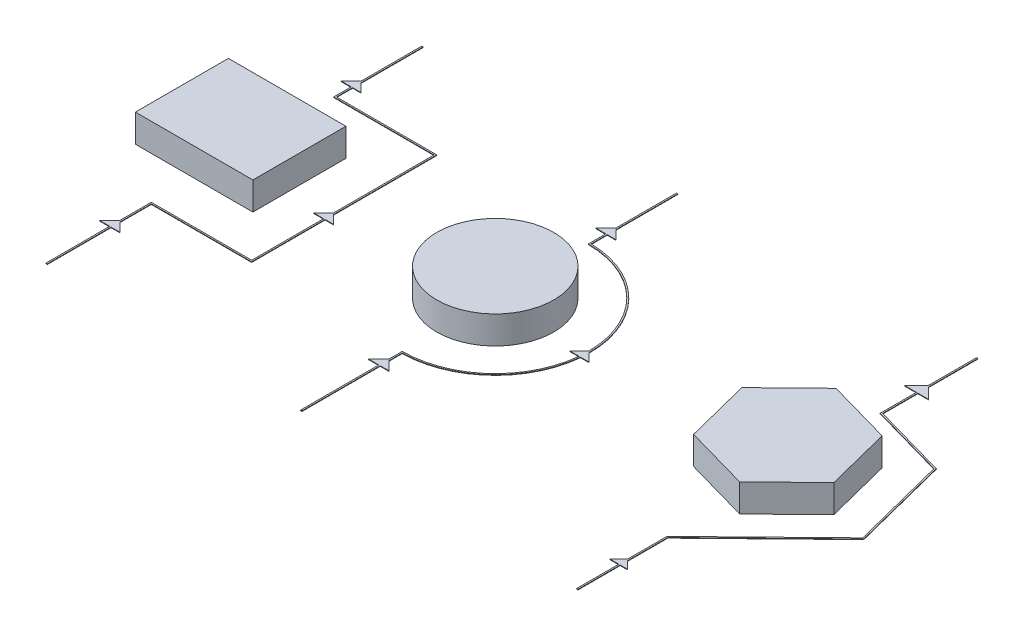
from build123d import *

# Parameters (mm, degrees)
SKETCH1_W             = 42.222572062
SKETCH1_H             = 33.426202882
BOSS_EXTRUDE1_DEPTH   = 10
BOSS_EXTRUDE1_2_DEPTH = 10
SKETCH1_R             = 21.024058424
BOSS_EXTRUDE1_3_DEPTH = 10
BOSS_EXTRUDE3_DEPTH   = 0.2
BOSS_EXTRUDE3_2_DEPTH = 0.2
BOSS_EXTRUDE3_3_DEPTH = 0.2
BOSS_EXTRUDE3_4_DEPTH = 0.2
BOSS_EXTRUDE3_5_DEPTH = 0.2
BOSS_EXTRUDE3_6_DEPTH = 0.2
BOSS_EXTRUDE3_7_DEPTH = 0.2
BOSS_EXTRUDE3_8_DEPTH = 0.2
EXTRUDE_THIN1_DEPTH   = 0.2


with BuildPart() as part:
    # Sketch1 → Boss-Extrude1 (new body)
    with BuildSketch(Plane(origin=(0, 0, 0), x_dir=(1, 0, 0), z_dir=(0, 1, 0))):
        with Locations((-158.114736003, 0)):
            Rectangle(SKETCH1_W, SKETCH1_H)
    extrude(amount=BOSS_EXTRUDE1_DEPTH)


with BuildPart() as body_2:
    # Sketch1 → Boss-Extrude1 2 (new body)
    with BuildSketch(Plane(origin=(0, 0, 0), x_dir=(1, 0, 0), z_dir=(0, 1, 0))):
        Polygon((61.534545535, -6.498313662), (55.637035061, 16.713101441), (32.586604687, 23.211415103), (15.433684787, 6.498313662), (21.331195261, -16.713101441), (44.381625635, -23.211415103), align=None)
    extrude(amount=BOSS_EXTRUDE1_2_DEPTH)


with BuildPart() as body_3:
    # Sketch1 → Boss-Extrude1 3 (new body)
    with BuildSketch(Plane(origin=(0, 0, 0), x_dir=(1, 0, 0), z_dir=(0, 1, 0))):
        with Locations((-66.632496535, 0)):
            Circle(SKETCH1_R)
    extrude(amount=BOSS_EXTRUDE1_3_DEPTH)


with BuildPart() as body_4:
    # Sketch1<5> → Boss-Extrude3 (new body)
    with BuildSketch(Plane(origin=(0, 0, 0), x_dir=(1, 0, 0), z_dir=(0, 1, 0))):
        Polygon((-161.789605496, 39.719403423), (-154.550133398, 39.719403423), (-158.169869447, 43.339139472), align=None)
    extrude(amount=BOSS_EXTRUDE3_DEPTH)



with BuildPart() as body_5:
    # Sketch1<5> → Boss-Extrude3 2 (new body)
    with BuildSketch(Plane(origin=(0, 0, 0), x_dir=(1, 0, 0), z_dir=(0, 1, 0))):
        Polygon((-125.711262238, -6.240180357), (-118.457543425, -6.240180357), (-122.084402832, -2.61332095), align=None)
    extrude(amount=BOSS_EXTRUDE3_2_DEPTH)


with BuildPart() as body_6:
    # Sketch1<5> → Boss-Extrude3 3 (new body)
    with BuildSketch(Plane(origin=(0, 0, 0), x_dir=(1, 0, 0), z_dir=(0, 1, 0))):
        Polygon((-154.487876597, -47.054493097), (-158.114736003, -43.42763369), (-161.74159541, -47.054493097), align=None)
    extrude(amount=BOSS_EXTRUDE3_3_DEPTH)


with BuildPart() as body_7:
    # Sketch1<5> → Boss-Extrude3 4 (new body)
    with BuildSketch(Plane(origin=(0, 0, 0), x_dir=(1, 0, 0), z_dir=(0, 1, 0))):
        Polygon((-70.247620953, -41.854454505), (-62.993902139, -41.854454505), (-66.620761546, -38.227595098), align=None)
    extrude(amount=BOSS_EXTRUDE3_4_DEPTH)


with BuildPart() as body_8:
    # Sketch1<5> → Boss-Extrude3 5 (new body)
    with BuildSketch(Plane(origin=(0, 0, 0), x_dir=(1, 0, 0), z_dir=(0, 1, 0))):
        Polygon((-70.247620953, 39.724015055), (-62.993902139, 39.724015055), (-66.632496535, 43.339139472), align=None)
    extrude(amount=BOSS_EXTRUDE3_5_DEPTH)


with BuildPart() as body_9:
    # Sketch1<5> → Boss-Extrude3 6 (new body)
    with BuildSketch(Plane(origin=(0, 0, 0), x_dir=(1, 0, 0), z_dir=(0, 1, 0))):
        Polygon((-36.556845653, -3.188815019), (-29.813104019, -3.188815019), (-33.206794515, 0.182985198), align=None)
    extrude(amount=BOSS_EXTRUDE3_6_DEPTH)


with BuildPart() as body_10:
    # Sketch1<5> → Boss-Extrude3 7 (new body)
    with BuildSketch(Plane(origin=(0, 0, 0), x_dir=(1, 0, 0), z_dir=(0, 1, 0))):
        Polygon((34.182162541, 46.208758205), (42.786067781, 46.208758205), (38.484115161, 50.510710825), align=None)
    extrude(amount=BOSS_EXTRUDE3_7_DEPTH)


with BuildPart() as body_11:
    # Sketch1<5> → Boss-Extrude3 8 (new body)
    with BuildSketch(Plane(origin=(0, 0, 0), x_dir=(1, 0, 0), z_dir=(0, 1, 0))):
        Polygon((41.564686711, -60.744358452), (38.484115161, -57.663786901), (35.40354361, -60.744358452), align=None)
    extrude(amount=BOSS_EXTRUDE3_8_DEPTH)


with BuildPart() as body_4_1:
    add(body_4.part)

    add(body_5.part)  # Extrude-Thin1 merges body 5

    add(body_6.part)  # Extrude-Thin1 merges body 6

    add(body_7.part)  # Extrude-Thin1 merges body 7

    add(body_8.part)  # Extrude-Thin1 merges body 8

    add(body_9.part)  # Extrude-Thin1 merges body 9

    add(body_10.part)  # Extrude-Thin1 merges body 10

    add(body_11.part)  # Extrude-Thin1 merges body 11
    # Sketch1<6> → Extrude-Thin1 (add)
    with BuildSketch(Plane(origin=(0, 0, 0), x_dir=(1, 0, 0), z_dir=(0, 1, 0))):
        Polygon((-158.114736003, -69.931134978), (-158.114736003, -32.106747506), (-122.049622367, -32.106747506), (-122.049622367, 33.426202882), (-158.114736003, 33.426202882), (-158.114736003, 65.093131929), (-157.614736003, 65.093131929), (-157.614736003, 33.926202882), (-121.549622367, 33.926202882), (-121.549622367, -32.606747506), (-157.614736003, -32.606747506), (-157.614736003, -69.931134978), align=None)
        with BuildLine():
            Line((-66.632496535, -69.931134978), (-66.632496535, -33.426202882))
            ThreePointArc((-66.632496535, -33.426202882), (-33.206293653, 0), (-66.632496535, 33.426202882))
            Line((-66.632496535, 33.426202882), (-66.632496535, 65.093131929))
            Line((-66.632496535, 65.093131929), (-66.132496535, 65.093131929))
            Line((-66.132496535, 65.093131929), (-66.132496535, 33.922518215))
            ThreePointArc((-66.132496535, 33.922518215), (-32.706293653, 0), (-66.132496535, -33.922518215))
            Line((-66.132496535, -33.922518215), (-66.132496535, -69.931134978))
            Line((-66.132496535, -69.931134978), (-66.632496535, -69.931134978))
        make_face()
        Polygon((38.484115161, -75.86382441), (38.484115161, -43.42763369), (74.106727986, -8.718421193), (65.38310896, 25.615988777), (38.484115161, 33.199278809), (38.484115161, 67.82214284), (38.984115161, 67.82214284), (38.984115161, 33.577809682), (65.796624306, 26.018901165), (74.662418023, -8.875079793), (38.984115161, -43.638554377), (38.984115161, -75.86382441), align=None)
    extrude(amount=EXTRUDE_THIN1_DEPTH)


solid = Compound([part.part, body_2.part, body_3.part, body_4_1.part])
